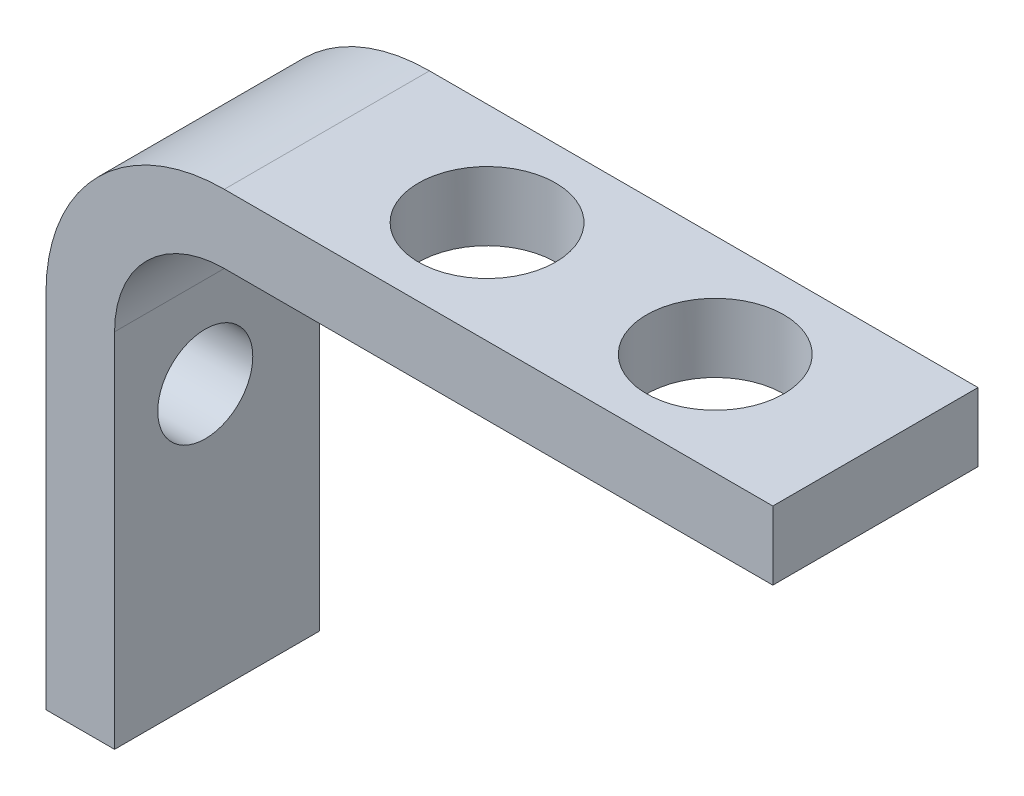
from build123d import *

# Parameters (mm, degrees)
BOSS_EXTRUDE1_DEPTH = 4.75
CUT_EXTRUDE1_REACH  = 22.275
SKETCH2_R           = 1.1
SKETCH3_R           = 1.5875
CUT_EXTRUDE2_DEPTH  = 2.54


with BuildPart() as part:
    # Sketch1 → Boss-Extrude1 (new body)
    with BuildSketch(Plane.XY):
        with BuildLine():
            Line((0, 0), (0, 8.3725))
            ThreePointArc((0, 8.3725), (0.743948776, 10.168551224), (2.54, 10.9125))
            Line((2.54, 10.9125), (15.24, 10.9125))
            Line((15.24, 10.9125), (15.24, 12.5))
            Line((15.24, 12.5), (2.54, 12.5))
            ThreePointArc((2.54, 12.5), (-0.378583239, 11.291083239), (-1.5875, 8.3725))
            Line((-1.5875, 8.3725), (-1.5875, 0))
            Line((-1.5875, 0), (0, 0))
        make_face()
    extrude(amount=BOSS_EXTRUDE1_DEPTH)

    # Sketch2 → Cut-Extrude1 (cut, up to next)
    with BuildSketch(Plane(origin=(0, 0, 0), x_dir=(0, 0, -1), z_dir=(1, 0, 0)), mode=Mode.PRIVATE) as cut_extrude1_sk1:
        with Locations((-2.65, 6.277)):
            Circle(SKETCH2_R)
    cut_extrude1_tool1 = extrude(cut_extrude1_sk1.sketch, amount=-CUT_EXTRUDE1_REACH, mode=Mode.PRIVATE) & part.part
    add(cut_extrude1_tool1.solids().sort_by_distance((0, 6.277, 2.65))[0], mode=Mode.SUBTRACT)

    # Sketch3 → Cut-Extrude2 (cut)
    with BuildSketch(Plane.XZ.offset(-10.9125)):
        with Locations((11.5316, 2.375)):
            Circle(SKETCH3_R)
        with Locations((6.2484, 2.375)):
            Circle(SKETCH3_R)
    extrude(amount=-CUT_EXTRUDE2_DEPTH, mode=Mode.SUBTRACT)


solid = part.part
